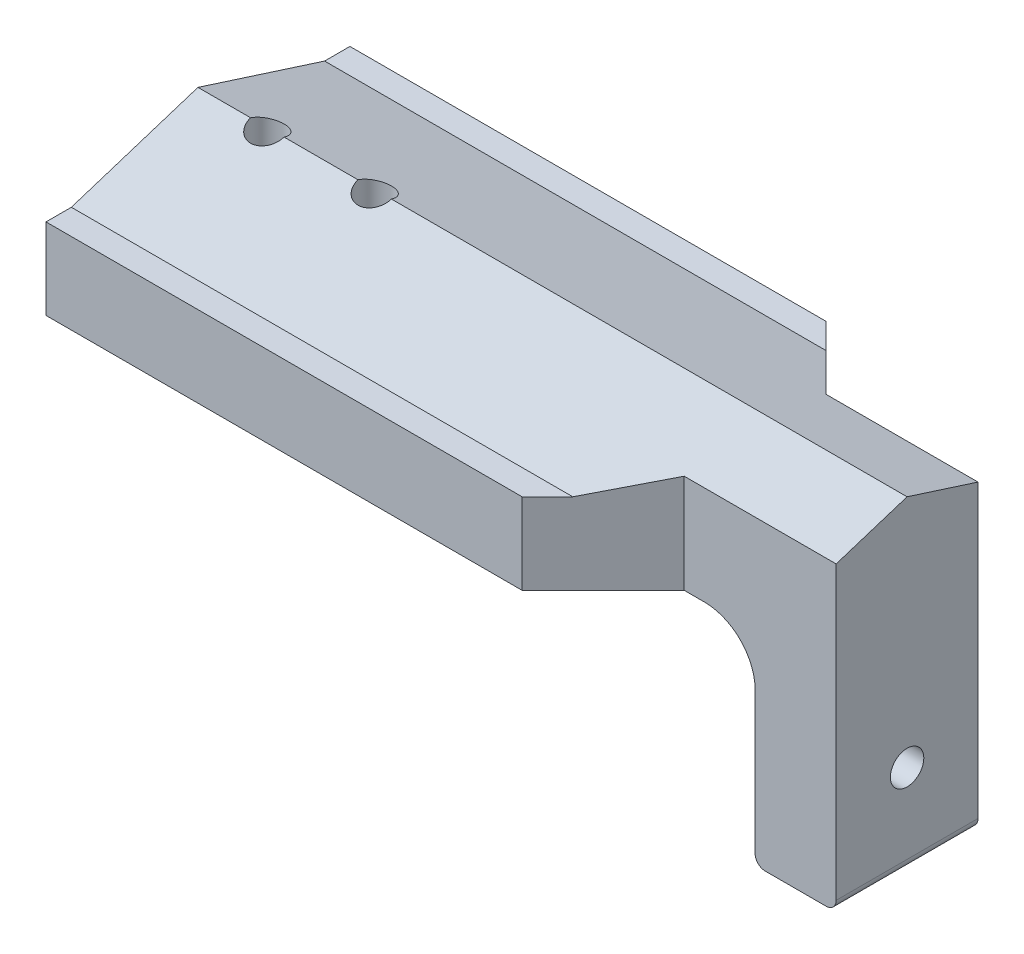
from build123d import *

# Parameters (mm, degrees)
BOSS_EXTRUDE1_DEPTH = 70
SKETCH2_R           = 1.65
CUT_EXTRUDE1_DEPTH  = 5
SKETCH3_R           = 1.65
CUT_EXTRUDE2_DEPTH  = 61
SKETCH4_W           = 8
SKETCH4_H           = 30
BOSS_EXTRUDE2_DEPTH = 20
SKETCH5_R           = 1.65
CUT_EXTRUDE3_DEPTH  = 4
SKETCH6_R           = 1.65
CUT_EXTRUDE4_DEPTH  = 40
FILLET1_R           = 1
FILLET2_R           = 5
SKETCH7_W           = 6
SKETCH7_H           = 8
SKETCH7_W_2         = 1
CUT_EXTRUDE5_DEPTH  = 42
CHAMFER1_SIZE       = 10


with BuildPart() as part:
    # Sketch1 → Boss-Extrude1 (new body)
    with BuildSketch(Plane(origin=(0, 0, 0), x_dir=(0, 0, -1), z_dir=(1, 0, 0))):
        Polygon((0, 8), (12.5, 4), (-12.5, 4), align=None)
        Polygon((12.5, 4), (-12.5, 4), (-15, 4), (-15, -4), (15, -4), (15, 4), align=None)
    extrude(amount=BOSS_EXTRUDE1_DEPTH)

    # Sketch2 → Cut-Extrude1 (cut)
    # profile 1 of 2: a face of its own
    with BuildSketch(Plane.XZ.offset(4)):
        Polygon((6.85, 3.290896534), (4, 1.645448267), (4, -1.645448267), (6.85, -3.290896534), (9.7, -1.645448267), (9.7, 1.645448267), align=None)
        with Locations(Location((6.85, 0, 0), (0, 0, 270))):
            Circle(SKETCH2_R, mode=Mode.SUBTRACT)
    # profile 2 of 2: a face of its own
    with BuildSketch(Plane.XZ.offset(4)):
        Polygon((17.45, -3.290896534), (20.3, -1.645448267), (20.3, 1.645448267), (17.45, 3.290896534), (14.6, 1.645448267), (14.6, -1.645448267), align=None)
        with Locations(Location((17.45, 0, 0), (0, 0, 270))):
            Circle(SKETCH2_R, mode=Mode.SUBTRACT)
    extrude(amount=-CUT_EXTRUDE1_DEPTH, mode=Mode.SUBTRACT)

    # Sketch3 → Cut-Extrude2 (cut)
    with BuildSketch(Plane.XZ.offset(4)):
        with Locations(Location((6.85, 0, 0), (0, 0, 270))):
            Circle(SKETCH3_R)
        with Locations(Location((17.45, 0, 0), (0, 0, 270))):
            Circle(SKETCH3_R)
    extrude(amount=-CUT_EXTRUDE2_DEPTH, mode=Mode.SUBTRACT)

    # Sketch4 → Boss-Extrude2 (add)
    with BuildSketch(Plane.XZ.offset(4)):
        with Locations((66, 0)):
            Rectangle(SKETCH4_W, SKETCH4_H)
    extrude(amount=BOSS_EXTRUDE2_DEPTH)

    # Sketch5 → Cut-Extrude3 (cut)
    with BuildSketch(Plane.ZY.offset(-62)):
        Polygon((3.290896534, -15.15), (1.645448267, -12.3), (-1.645448267, -12.3), (-3.290896534, -15.15), (-1.645448267, -18), (1.645448267, -18), align=None)
        with Locations((0, -15.15)):
            Circle(SKETCH5_R, mode=Mode.SUBTRACT)
    extrude(amount=-CUT_EXTRUDE3_DEPTH, mode=Mode.SUBTRACT)

    # Sketch6 → Cut-Extrude4 (cut)
    with BuildSketch(Plane.ZY.offset(-62)):
        with Locations((0, -15.15)):
            Circle(SKETCH6_R)
    extrude(amount=-CUT_EXTRUDE4_DEPTH, mode=Mode.SUBTRACT)

    # Fillet1
    fillet1_edges = [part.edges().sort_by_distance(p)[0] for p in [
        (70, -24, 0),
        (62, -24, 0),
    ]]
    fillet(fillet1_edges, radius=FILLET1_R)

    # Fillet2
    fillet2_edges = [part.edges().sort_by_distance(p)[0] for p in [
        (62, -4, 0),
    ]]
    fillet(fillet2_edges, radius=FILLET2_R)

    # Sketch7 → Cut-Extrude5 (cut)
    with BuildSketch(Plane.XZ.offset(24)):
        with Locations((66, 11)):
            Rectangle(SKETCH7_W, SKETCH7_H)
        with Locations((69.5, 11)):
            Rectangle(SKETCH7_W_2, SKETCH7_H)
        with Locations((60, 11)):
            Rectangle(SKETCH7_W, SKETCH7_H)
        with Locations((60, -11)):
            Rectangle(SKETCH7_W, SKETCH7_H)
        with Locations((66, -11)):
            Rectangle(SKETCH7_W, SKETCH7_H)
        with Locations((69.5, -11)):
            Rectangle(SKETCH7_W_2, SKETCH7_H)
    extrude(amount=-CUT_EXTRUDE5_DEPTH, mode=Mode.SUBTRACT)

    # Chamfer1
    # the kernel refuses this chamfer: 10 mm, written as the material it takes off along each edge
    with BuildSketch(Plane(origin=(57, -29.71682988, 15), x_dir=(0.027495876610587014, 0, -0.9996219169112968), z_dir=(0, 1, 0))) as chamfer1_piece_1_section:
        Polygon((CHAMFER1_SIZE * 0.999621916911, CHAMFER1_SIZE * 0.0274958766106), (-CHAMFER1_SIZE * 0.0274958766106, CHAMFER1_SIZE * 0.999621916911), (0, 0), align=None)
    chamfer1_piece_1 = extrude(amount=59.433659759, mode=Mode.PRIVATE)
    chamfer1_piece_1 = split(chamfer1_piece_1, bisect_by=Plane(origin=(53.542815877, 0, 7), z_dir=(0, 0, 1)), keep=Keep.TOP, mode=Mode.PRIVATE)
    add(chamfer1_piece_1, mode=Mode.SUBTRACT)
    with BuildSketch(Plane(origin=(57, -29.71682988, -15), x_dir=(-0.9996219169112968, 0, -0.027495876610586317), z_dir=(0, 1, 0))) as chamfer1_piece_2_section:
        Polygon((CHAMFER1_SIZE * 0.999621916911, CHAMFER1_SIZE * 0.0274958766106), (-CHAMFER1_SIZE * 0.0274958766106, CHAMFER1_SIZE * 0.999621916911), (0, 0), align=None)
    chamfer1_piece_2 = extrude(amount=59.433659759, mode=Mode.PRIVATE)
    chamfer1_piece_2 = split(chamfer1_piece_2, bisect_by=Plane(origin=(53.542815877, 0, -7), z_dir=(0, 0, -1)), keep=Keep.TOP, mode=Mode.PRIVATE)
    add(chamfer1_piece_2, mode=Mode.SUBTRACT)


solid = part.part
